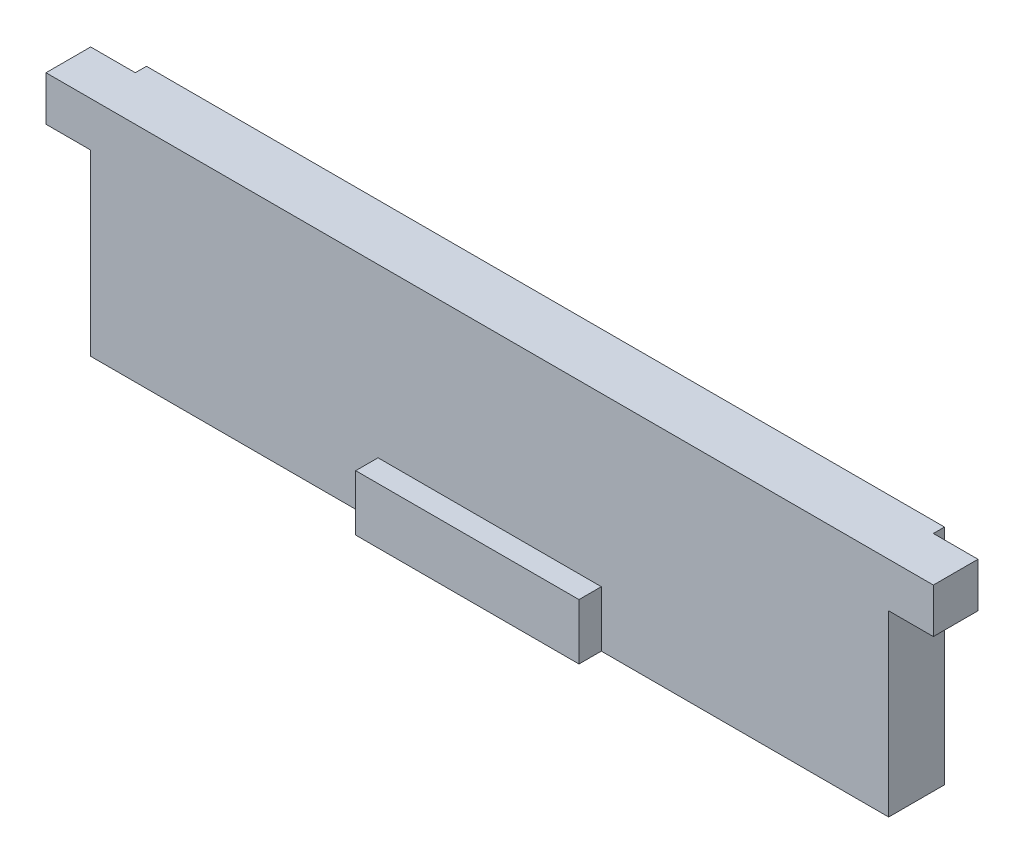
from build123d import *

# Parameters (mm, degrees)
SKETCH_1_W      = 71.485224
SKETCH_1_H      = 5
EXTRUDE_1_DEPTH = 20
SKETCH_3_W      = 20
SKETCH_3_H      = 5
EXTRUDE_3_DEPTH = 2
SKETCH_4_W      = 4
SKETCH_4_H      = 4
EXTRUDE_4_DEPTH = 4


with BuildPart() as part:
    # 草图1 → 凸台-拉伸1 (new body)
    with BuildSketch(Plane(origin=(0, 0, 0), x_dir=(1, 0, 0), z_dir=(0, 1, 0))):
        with Locations((35.742612, 2.5)):
            Rectangle(SKETCH_1_W, SKETCH_1_H)
    extrude(amount=EXTRUDE_1_DEPTH)

    # 草图3 → 凸台-拉伸3 (add)
    with BuildSketch(Plane.XY):
        with Locations((35.742612, 2.5)):
            Rectangle(SKETCH_3_W, SKETCH_3_H)
    extrude(amount=EXTRUDE_3_DEPTH)

    # 草图4 → 凸台-拉伸4 (add)
    with BuildSketch(Plane(origin=(0, 20, 0), x_dir=(1, 0, 0), z_dir=(0, 1, 0))):
        with Locations((-2, 2)):
            Rectangle(SKETCH_4_W, SKETCH_4_H)
        with Locations((73.485224, 2)):
            Rectangle(SKETCH_4_W, SKETCH_4_H)
    extrude(amount=-EXTRUDE_4_DEPTH)


solid = part.part
